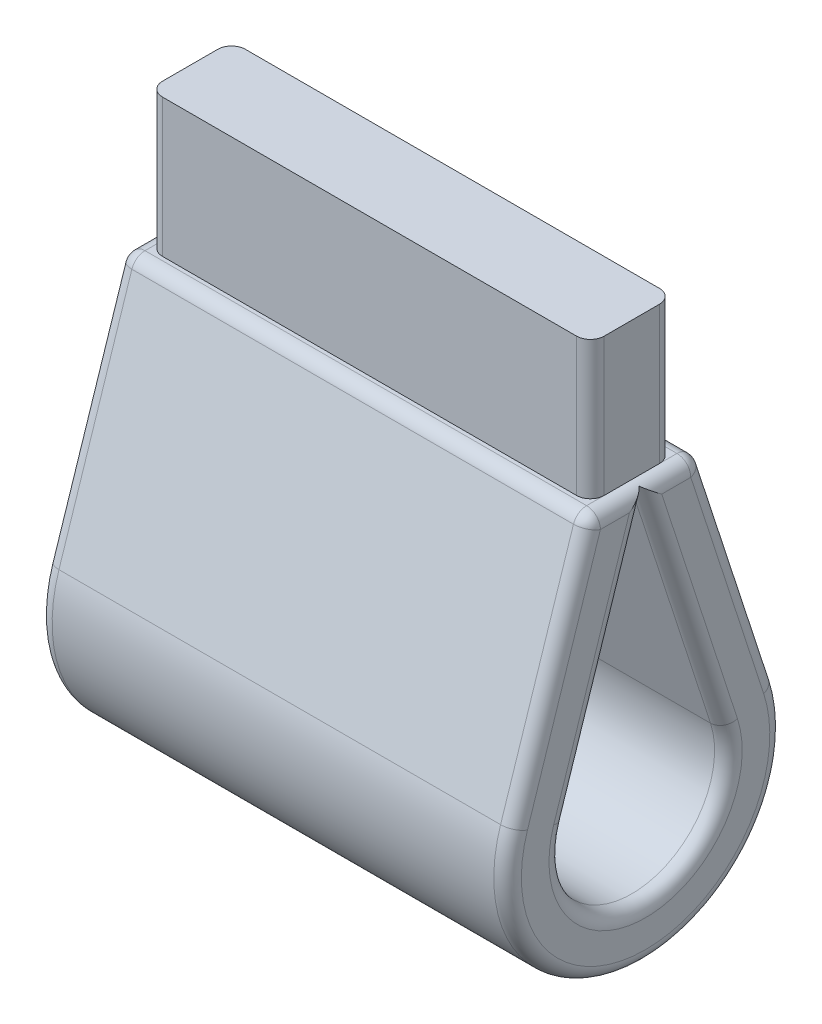
from build123d import *

# Parameters (mm, degrees)
BOSS_EXTRUDE1_DEPTH = 34
SKETCH2_W           = 34
SKETCH2_H           = 8
SKETCH2_W_2         = 32
SKETCH2_H_2         = 6
CUT_EXTRUDE1_DEPTH  = 10
FILLET1_R           = 1
FILLET2_R           = 1


with BuildPart() as part:
    # Sketch1 → Boss-Extrude1 (new body)
    with BuildSketch(Plane(origin=(0, 0, 0), x_dir=(0, 0, -1), z_dir=(1, 0, 0))):
        with BuildLine():
            Line((-9.507879247, 3.098424151), (-4, 20))
            Line((-4, 20), (-4, 30))
            Line((-4, 30), (4, 30))
            Line((4, 30), (4, 20))
            Line((4, 20), (9.507879247, 3.098424151))
            ThreePointArc((9.507879247, 3.098424151), (0, -10), (-9.507879247, 3.098424151))
        make_face()
        with BuildLine():
            Line((-5.704727548, 1.85905449), (0, 19.364682524))
            Line((0, 19.364682524), (5.704727548, 1.85905449))
            ThreePointArc((5.704727548, 1.85905449), (0, -6), (-5.704727548, 1.85905449))
        make_face(mode=Mode.SUBTRACT)
    extrude(amount=BOSS_EXTRUDE1_DEPTH)

    # Sketch2 → Cut-Extrude1 (cut)
    with BuildSketch(Plane(origin=(0, 30, 0), x_dir=(1, 0, 0), z_dir=(0, 1, 0))):
        with Locations((17, 0)):
            Rectangle(SKETCH2_W, SKETCH2_H)
        with Locations((17, 0)):
            Rectangle(SKETCH2_W_2, SKETCH2_H_2, mode=Mode.SUBTRACT)
    extrude(amount=-CUT_EXTRUDE1_DEPTH, mode=Mode.SUBTRACT)

    # Fillet1
    # the kernel refuses this fillet: 1 mm, written as the material it takes off along each edge
    with BuildSketch(Plane(origin=(1, 19, 3.274120372), x_dir=(0, 0.3098424150516233, 0.9507879247418836), z_dir=(-1, 0, 0))) as fillet1_piece_1_section:
        Polygon((0, 0), (FILLET1_R * 1.02, 0), (FILLET1_R * 1.02, FILLET1_R * 0.740397220377), (FILLET1_R * 0.316039263353, FILLET1_R * 0.969803683237), align=None)
    fillet1_piece_1 = extrude(amount=FILLET1_R * 1.02, mode=Mode.PRIVATE)
    fillet1_piece_1 = fillet1_piece_1 - Plane(origin=(1, 19, 3.274120372), x_dir=(0, -0.8092720231948041, -0.5874340750026239), z_dir=(-1, 0, 0)) * Sphere(FILLET1_R, mode=Mode.PRIVATE)
    add(fillet1_piece_1, mode=Mode.SUBTRACT)
    with BuildSketch(Plane(origin=(33, 19, 3.274120372), x_dir=(0, 0.3098424150516233, 0.9507879247418836), z_dir=(1, 0, 0))) as fillet1_piece_2_section:
        Polygon((0, 0), (FILLET1_R * 1.02, 0), (FILLET1_R * 1.02, -FILLET1_R * 0.740397220377), (FILLET1_R * 0.316039263353, -FILLET1_R * 0.969803683237), align=None)
    fillet1_piece_2 = extrude(amount=FILLET1_R * 1.02, mode=Mode.PRIVATE)
    fillet1_piece_2 = fillet1_piece_2 - Plane(origin=(33, 19, 3.274120372), x_dir=(0, -0.8092720231948041, -0.5874340750026239), z_dir=(1, 0, 0)) * Sphere(FILLET1_R, mode=Mode.PRIVATE)
    add(fillet1_piece_2, mode=Mode.SUBTRACT)
    with BuildSketch(Plane(origin=(1, 19, -3.274120372), x_dir=(0, 0.3098424150516232, -0.9507879247418838), z_dir=(-1, 0, 0))) as fillet1_piece_3_section:
        Polygon((0, 0), (FILLET1_R * 1.02, 0), (FILLET1_R * 1.02, -FILLET1_R * 0.740397220377), (FILLET1_R * 0.316039263353, -FILLET1_R * 0.969803683237), align=None)
    fillet1_piece_3 = extrude(amount=FILLET1_R * 1.02, mode=Mode.PRIVATE)
    fillet1_piece_3 = fillet1_piece_3 - Plane(origin=(1, 19, -3.274120372), x_dir=(0, -0.8092720231948041, 0.587434075002624), z_dir=(-1, 0, 0)) * Sphere(FILLET1_R, mode=Mode.PRIVATE)
    add(fillet1_piece_3, mode=Mode.SUBTRACT)
    with BuildSketch(Plane(origin=(33, 19, -3.274120372), x_dir=(0, 0.3098424150516232, -0.9507879247418838), z_dir=(1, 0, 0))) as fillet1_piece_4_section:
        Polygon((0, 0), (FILLET1_R * 1.02, 0), (FILLET1_R * 1.02, FILLET1_R * 0.740397220377), (FILLET1_R * 0.316039263353, FILLET1_R * 0.969803683237), align=None)
    fillet1_piece_4 = extrude(amount=FILLET1_R * 1.02, mode=Mode.PRIVATE)
    fillet1_piece_4 = fillet1_piece_4 - Plane(origin=(33, 19, -3.274120372), x_dir=(0, -0.8092720231948041, 0.587434075002624), z_dir=(1, 0, 0)) * Sphere(FILLET1_R, mode=Mode.PRIVATE)
    add(fillet1_piece_4, mode=Mode.SUBTRACT)
    with BuildSketch(Plane(origin=(1, 20, 4), x_dir=(0, -0.9507879247418841, 0.30984241505162113), z_dir=(1, 0, 0)), Plane(origin=(1, 20, -4), x_dir=(0, 0, 1), z_dir=(1, 0, 0))) as fillet1_piece_5:
        with BuildLine():
            CenterArc((FILLET1_R * 0.725879627821, FILLET1_R), FILLET1_R, 198.04973395, 71.95026605)
            Line((-FILLET1_R * 0.224908296921, FILLET1_R * 0.690157584948), (-FILLET1_R * 0.243924055416, FILLET1_R * 0.683960736647))
            Line((-FILLET1_R * 0.243924055416, FILLET1_R * 0.683960736647), (-FILLET1_R * 0.0145175925564, -FILLET1_R * 0.02))
            Line((-FILLET1_R * 0.0145175925564, -FILLET1_R * 0.02), (FILLET1_R * 0.725879627821, -FILLET1_R * 0.02))
            Line((FILLET1_R * 0.725879627821, -FILLET1_R * 0.02), (FILLET1_R * 0.725879627821, 0))
        make_face()
    extrude(amount=32, mode=Mode.SUBTRACT)
    with BuildSketch(Plane(origin=(0, 0, 0), x_dir=(0, 0.3098424150516232, -0.9507879247418836), z_dir=(0, 0.9507879247418836, 0.3098424150516232))) as fillet1_piece_6:
        with BuildLine():
            CenterArc((6 + FILLET1_R, -FILLET1_R), FILLET1_R, 90, 90)
            Line((6, -FILLET1_R), (6 - FILLET1_R * 0.02, -FILLET1_R))
            Line((6 - FILLET1_R * 0.02, -FILLET1_R), (6 - FILLET1_R * 0.02, FILLET1_R * 0.02))
            Line((6 - FILLET1_R * 0.02, FILLET1_R * 0.02), (6 + FILLET1_R, FILLET1_R * 0.02))
            Line((6 + FILLET1_R, FILLET1_R * 0.02), (6 + FILLET1_R, 0))
        make_face()
    revolve(axis=Axis((0, 0, 0), (-1, 0, 0)), revolution_arc=216.0994679, mode=Mode.SUBTRACT)
    with BuildSketch(Plane(origin=(0, 21.741652336, 0.774606038), x_dir=(0, 0.30984241505162313, -0.9507879247418837), z_dir=(0, -0.9507879247418837, -0.30984241505162313))) as fillet1_piece_7_section:
        with BuildLine():
            CenterArc((FILLET1_R, FILLET1_R), FILLET1_R, 180, 90)
            Line((0, FILLET1_R), (-FILLET1_R * 0.02, FILLET1_R))
            Line((-FILLET1_R * 0.02, FILLET1_R), (-FILLET1_R * 0.02, -FILLET1_R * 0.02))
            Line((-FILLET1_R * 0.02, -FILLET1_R * 0.02), (FILLET1_R, -FILLET1_R * 0.02))
            Line((FILLET1_R, -FILLET1_R * 0.02), (FILLET1_R, 0))
        make_face()
    fillet1_piece_7 = extrude(amount=20.91170631, mode=Mode.PRIVATE)
    fillet1_piece_7 = split(fillet1_piece_7, bisect_by=Plane(origin=(0.224383955, 12.542231939, 2.223297658), z_dir=(0, -0.30984241505162313, -0.9507879247418837)), keep=Keep.TOP, mode=Mode.PRIVATE)
    add(fillet1_piece_7, mode=Mode.SUBTRACT)
    with BuildSketch(Plane(origin=(34, 3.098424151, 9.507879247), x_dir=(-1, 0, 0), z_dir=(0, 0.9507879247418836, -0.3098424150516233)), Plane(origin=(0, 19.309842415, -4.224908297), x_dir=(0, -0.3098424150516232, 0.9507879247418837), z_dir=(0, -0.9507879247418837, -0.3098424150516232))) as fillet1_piece_8:
        with BuildLine():
            CenterArc((FILLET1_R, -FILLET1_R), FILLET1_R, 90, 90)
            Line((0, -FILLET1_R), (-FILLET1_R * 0.02, -FILLET1_R))
            Line((-FILLET1_R * 0.02, -FILLET1_R), (-FILLET1_R * 0.02, FILLET1_R * 0.02))
            Line((-FILLET1_R * 0.02, FILLET1_R * 0.02), (FILLET1_R, FILLET1_R * 0.02))
            Line((FILLET1_R, FILLET1_R * 0.02), (FILLET1_R, 0))
        make_face()
    extrude(amount=17.050509207, mode=Mode.SUBTRACT)
    with BuildSketch(Plane(origin=(0, 1.85905449, 5.704727548), x_dir=(0, 0.3098424150516232, 0.9507879247418837), z_dir=(0, 0.9507879247418837, -0.30984241505162313))) as fillet1_piece_9_section:
        with BuildLine():
            CenterArc((FILLET1_R, FILLET1_R), FILLET1_R, 180, 90)
            Line((0, FILLET1_R), (-FILLET1_R * 0.02, FILLET1_R))
            Line((-FILLET1_R * 0.02, FILLET1_R), (-FILLET1_R * 0.02, -FILLET1_R * 0.02))
            Line((-FILLET1_R * 0.02, -FILLET1_R * 0.02), (FILLET1_R, -FILLET1_R * 0.02))
            Line((FILLET1_R, -FILLET1_R * 0.02), (FILLET1_R, 0))
        make_face()
    fillet1_piece_9 = extrude(amount=20.91170631, mode=Mode.PRIVATE)
    fillet1_piece_9 = split(fillet1_piece_9, bisect_by=Plane(origin=(0.224383955, 12.542231939, -2.223297658), z_dir=(0, -0.30984241505162313, 0.9507879247418837)), keep=Keep.TOP, mode=Mode.PRIVATE)
    add(fillet1_piece_9, mode=Mode.SUBTRACT)
    with BuildSketch(Plane(origin=(34, 0, 0), x_dir=(0, 0.3098424150516232, -0.9507879247418836), z_dir=(0, 0.9507879247418836, 0.3098424150516232))) as fillet1_piece_10:
        with BuildLine():
            CenterArc((6 + FILLET1_R, FILLET1_R), FILLET1_R, 180, 90)
            Line((6, FILLET1_R), (6 - FILLET1_R * 0.02, FILLET1_R))
            Line((6 - FILLET1_R * 0.02, FILLET1_R), (6 - FILLET1_R * 0.02, -FILLET1_R * 0.02))
            Line((6 - FILLET1_R * 0.02, -FILLET1_R * 0.02), (6 + FILLET1_R, -FILLET1_R * 0.02))
            Line((6 + FILLET1_R, -FILLET1_R * 0.02), (6 + FILLET1_R, 0))
        make_face()
    revolve(axis=Axis((34, 0, 0), (-1, 0, 0)), revolution_arc=216.0994679, mode=Mode.SUBTRACT)
    with BuildSketch(Plane(origin=(34, 21.741652336, 0.774606038), x_dir=(0, 0.30984241505162313, -0.9507879247418837), z_dir=(0, -0.9507879247418837, -0.30984241505162313))) as fillet1_piece_11_section:
        with BuildLine():
            CenterArc((FILLET1_R, -FILLET1_R), FILLET1_R, 90, 90)
            Line((0, -FILLET1_R), (-FILLET1_R * 0.02, -FILLET1_R))
            Line((-FILLET1_R * 0.02, -FILLET1_R), (-FILLET1_R * 0.02, FILLET1_R * 0.02))
            Line((-FILLET1_R * 0.02, FILLET1_R * 0.02), (FILLET1_R, FILLET1_R * 0.02))
            Line((FILLET1_R, FILLET1_R * 0.02), (FILLET1_R, 0))
        make_face()
    fillet1_piece_11 = extrude(amount=20.91170631, mode=Mode.PRIVATE)
    fillet1_piece_11 = split(fillet1_piece_11, bisect_by=Plane(origin=(33.775616045, 12.542231939, 2.223297658), z_dir=(0, -0.30984241505162313, -0.9507879247418837)), keep=Keep.TOP, mode=Mode.PRIVATE)
    add(fillet1_piece_11, mode=Mode.SUBTRACT)
    with BuildSketch(Plane(origin=(34, 1.85905449, 5.704727548), x_dir=(0, 0.3098424150516232, 0.9507879247418837), z_dir=(0, 0.9507879247418837, -0.30984241505162313))) as fillet1_piece_12_section:
        with BuildLine():
            CenterArc((FILLET1_R, -FILLET1_R), FILLET1_R, 90, 90)
            Line((0, -FILLET1_R), (-FILLET1_R * 0.02, -FILLET1_R))
            Line((-FILLET1_R * 0.02, -FILLET1_R), (-FILLET1_R * 0.02, FILLET1_R * 0.02))
            Line((-FILLET1_R * 0.02, FILLET1_R * 0.02), (FILLET1_R, FILLET1_R * 0.02))
            Line((FILLET1_R, FILLET1_R * 0.02), (FILLET1_R, 0))
        make_face()
    fillet1_piece_12 = extrude(amount=20.91170631, mode=Mode.PRIVATE)
    fillet1_piece_12 = split(fillet1_piece_12, bisect_by=Plane(origin=(33.775616045, 12.542231939, -2.223297658), z_dir=(0, -0.30984241505162313, 0.9507879247418837)), keep=Keep.TOP, mode=Mode.PRIVATE)
    add(fillet1_piece_12, mode=Mode.SUBTRACT)
    with BuildSketch(Plane(origin=(34, 20, 3.274120372), x_dir=(-1, 0, 0), z_dir=(0, 0, -1)), Plane(origin=(0, 20, -3.274120372), x_dir=(1, 0, 0), z_dir=(0, 0, 1))) as fillet1_piece_13:
        with BuildLine():
            CenterArc((FILLET1_R, -FILLET1_R), FILLET1_R, 90, 90)
            Line((0, -FILLET1_R), (-FILLET1_R * 0.02, -FILLET1_R))
            Line((-FILLET1_R * 0.02, -FILLET1_R), (-FILLET1_R * 0.02, FILLET1_R * 0.02))
            Line((-FILLET1_R * 0.02, FILLET1_R * 0.02), (FILLET1_R, FILLET1_R * 0.02))
            Line((FILLET1_R, FILLET1_R * 0.02), (FILLET1_R, 0))
        make_face()
    extrude(amount=6.548240744, mode=Mode.SUBTRACT)
    with BuildSketch(Plane(origin=(34, 0, 0), x_dir=(0, 0.3098424150516232, -0.9507879247418837), z_dir=(0, 0.9507879247418837, 0.3098424150516232))) as fillet1_piece_14:
        with BuildLine():
            CenterArc((10 - FILLET1_R, FILLET1_R), FILLET1_R, 270, 90)
            Line((10 - FILLET1_R, 0), (10 - FILLET1_R, -FILLET1_R * 0.02))
            Line((10 - FILLET1_R, -FILLET1_R * 0.02), (10 + FILLET1_R * 0.02, -FILLET1_R * 0.02))
            Line((10 + FILLET1_R * 0.02, -FILLET1_R * 0.02), (10 + FILLET1_R * 0.02, FILLET1_R))
            Line((10 + FILLET1_R * 0.02, FILLET1_R), (10, FILLET1_R))
        make_face()
    revolve(axis=Axis((34, 0, 0), (-1, 0, 0)), revolution_arc=216.0994679, mode=Mode.SUBTRACT)
    with BuildSketch(Plane(origin=(0, 3.098424151, 9.507879247), x_dir=(1, 0, 0), z_dir=(0, 0.9507879247418836, -0.3098424150516233)), Plane(origin=(34, 19.309842415, -4.224908297), x_dir=(0, -0.3098424150516232, 0.9507879247418837), z_dir=(0, -0.9507879247418837, -0.3098424150516232))) as fillet1_piece_15:
        with BuildLine():
            CenterArc((FILLET1_R, FILLET1_R), FILLET1_R, 180, 90)
            Line((0, FILLET1_R), (-FILLET1_R * 0.02, FILLET1_R))
            Line((-FILLET1_R * 0.02, FILLET1_R), (-FILLET1_R * 0.02, -FILLET1_R * 0.02))
            Line((-FILLET1_R * 0.02, -FILLET1_R * 0.02), (FILLET1_R, -FILLET1_R * 0.02))
            Line((FILLET1_R, -FILLET1_R * 0.02), (FILLET1_R, 0))
        make_face()
    extrude(amount=17.050509207, mode=Mode.SUBTRACT)
    with BuildSketch(Plane(origin=(0, 0, 0), x_dir=(0, 0.3098424150516232, -0.9507879247418837), z_dir=(0, 0.9507879247418837, 0.3098424150516232))) as fillet1_piece_16:
        with BuildLine():
            CenterArc((10 - FILLET1_R, -FILLET1_R), FILLET1_R, 0, 90)
            Line((10 - FILLET1_R, 0), (10 - FILLET1_R, FILLET1_R * 0.02))
            Line((10 - FILLET1_R, FILLET1_R * 0.02), (10 + FILLET1_R * 0.02, FILLET1_R * 0.02))
            Line((10 + FILLET1_R * 0.02, FILLET1_R * 0.02), (10 + FILLET1_R * 0.02, -FILLET1_R))
            Line((10 + FILLET1_R * 0.02, -FILLET1_R), (10, -FILLET1_R))
        make_face()
    revolve(axis=Axis((0, 0, 0), (-1, 0, 0)), revolution_arc=216.0994679, mode=Mode.SUBTRACT)
    with BuildSketch(Plane(origin=(0, 21.741652336, 0.774606038), x_dir=(0, 0.30984241505162313, -0.9507879247418837), z_dir=(0, -0.9507879247418837, -0.30984241505162313))) as fillet1_piece_17a_section:
        with BuildLine():
            CenterArc((FILLET1_R, FILLET1_R), FILLET1_R, 180, 90)
            Line((0, FILLET1_R), (-FILLET1_R * 0.02, FILLET1_R))
            Line((-FILLET1_R * 0.02, FILLET1_R), (-FILLET1_R * 0.02, -FILLET1_R * 0.02))
            Line((-FILLET1_R * 0.02, -FILLET1_R * 0.02), (FILLET1_R, -FILLET1_R * 0.02))
            Line((FILLET1_R, -FILLET1_R * 0.02), (FILLET1_R, 0))
        make_face()
    fillet1_piece_17a = extrude(amount=20.91170631, mode=Mode.PRIVATE)
    fillet1_piece_17a = split(fillet1_piece_17a, bisect_by=Plane(origin=(0.243592095, 20.539413838, -0.382821003), z_dir=(0, 0.30984241505162313, 0.9507879247418837)), keep=Keep.TOP, mode=Mode.PRIVATE)
    with BuildSketch(Plane(origin=(0, 1.85905449, 5.704727548), x_dir=(0, 0.3098424150516232, 0.9507879247418837), z_dir=(0, 0.9507879247418837, -0.30984241505162313))) as fillet1_piece_17b_section:
        with BuildLine():
            CenterArc((FILLET1_R, FILLET1_R), FILLET1_R, 180, 90)
            Line((0, FILLET1_R), (-FILLET1_R * 0.02, FILLET1_R))
            Line((-FILLET1_R * 0.02, FILLET1_R), (-FILLET1_R * 0.02, -FILLET1_R * 0.02))
            Line((-FILLET1_R * 0.02, -FILLET1_R * 0.02), (FILLET1_R, -FILLET1_R * 0.02))
            Line((FILLET1_R, -FILLET1_R * 0.02), (FILLET1_R, 0))
        make_face()
    fillet1_piece_17b = extrude(amount=20.91170631, mode=Mode.PRIVATE)
    fillet1_piece_17b = split(fillet1_piece_17b, bisect_by=Plane(origin=(0.243592095, 20.539413838, 0.382821003), z_dir=(0, 0.30984241505162313, -0.9507879247418837)), keep=Keep.TOP, mode=Mode.PRIVATE)
    fillet1_piece_17 = fillet1_piece_17a & fillet1_piece_17b
    add(fillet1_piece_17, mode=Mode.SUBTRACT)
    with BuildSketch(Plane(origin=(34, 21.741652336, 0.774606038), x_dir=(0, 0.30984241505162313, -0.9507879247418837), z_dir=(0, -0.9507879247418837, -0.30984241505162313))) as fillet1_piece_18a_section:
        with BuildLine():
            CenterArc((FILLET1_R, -FILLET1_R), FILLET1_R, 90, 90)
            Line((0, -FILLET1_R), (-FILLET1_R * 0.02, -FILLET1_R))
            Line((-FILLET1_R * 0.02, -FILLET1_R), (-FILLET1_R * 0.02, FILLET1_R * 0.02))
            Line((-FILLET1_R * 0.02, FILLET1_R * 0.02), (FILLET1_R, FILLET1_R * 0.02))
            Line((FILLET1_R, FILLET1_R * 0.02), (FILLET1_R, 0))
        make_face()
    fillet1_piece_18a = extrude(amount=20.91170631, mode=Mode.PRIVATE)
    fillet1_piece_18a = split(fillet1_piece_18a, bisect_by=Plane(origin=(33.756407905, 20.539413838, -0.382821003), z_dir=(0, 0.30984241505162313, 0.9507879247418837)), keep=Keep.TOP, mode=Mode.PRIVATE)
    with BuildSketch(Plane(origin=(34, 1.85905449, 5.704727548), x_dir=(0, 0.3098424150516232, 0.9507879247418837), z_dir=(0, 0.9507879247418837, -0.30984241505162313))) as fillet1_piece_18b_section:
        with BuildLine():
            CenterArc((FILLET1_R, -FILLET1_R), FILLET1_R, 90, 90)
            Line((0, -FILLET1_R), (-FILLET1_R * 0.02, -FILLET1_R))
            Line((-FILLET1_R * 0.02, -FILLET1_R), (-FILLET1_R * 0.02, FILLET1_R * 0.02))
            Line((-FILLET1_R * 0.02, FILLET1_R * 0.02), (FILLET1_R, FILLET1_R * 0.02))
            Line((FILLET1_R, FILLET1_R * 0.02), (FILLET1_R, 0))
        make_face()
    fillet1_piece_18b = extrude(amount=20.91170631, mode=Mode.PRIVATE)
    fillet1_piece_18b = split(fillet1_piece_18b, bisect_by=Plane(origin=(33.756407905, 20.539413838, 0.382821003), z_dir=(0, 0.30984241505162313, -0.9507879247418837)), keep=Keep.TOP, mode=Mode.PRIVATE)
    fillet1_piece_18 = fillet1_piece_18a & fillet1_piece_18b
    add(fillet1_piece_18, mode=Mode.SUBTRACT)

    # Fillet2
    fillet2_edges = [part.edges().sort_by_distance(p)[0] for p in [
        (33, 25, -3),
        (33, 25, 3),
        (1, 25, 3),
        (1, 25, -3),
    ]]
    fillet(fillet2_edges, radius=FILLET2_R)


solid = part.part
